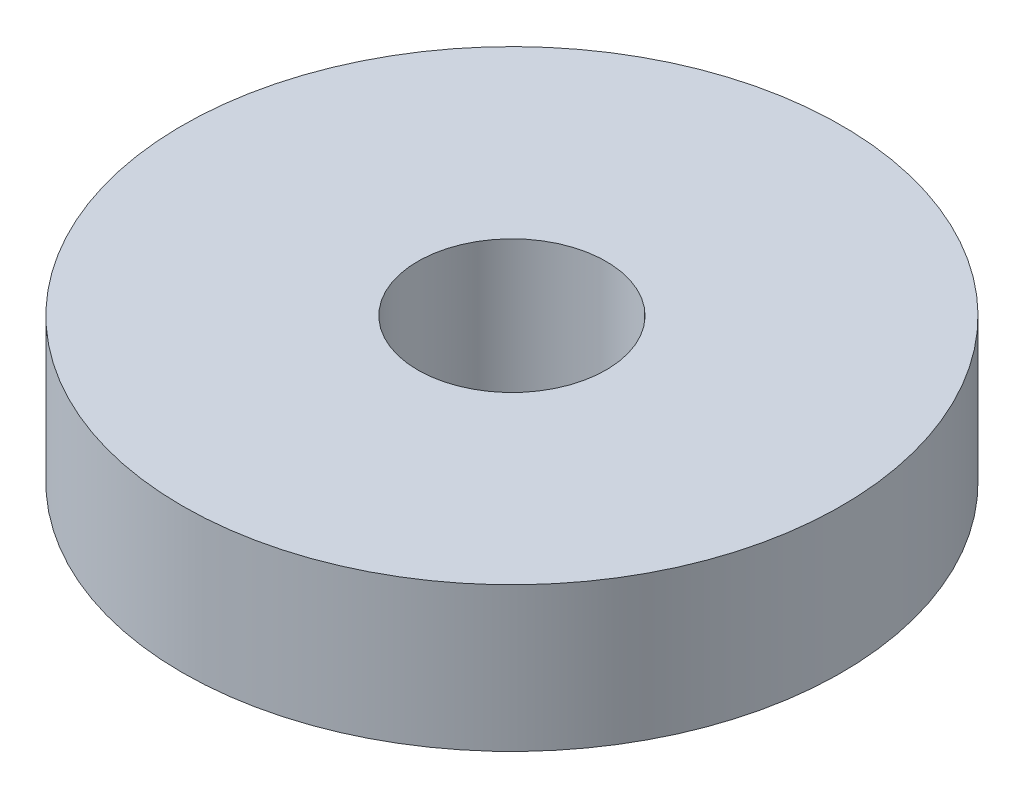
from build123d import *

# Parameters (mm, degrees)
SKETCH1_R           = 52.5
BOSS_EXTRUDE1_DEPTH = 23
SKETCH2_R           = 15
CUT_EXTRUDE1_DEPTH  = 78.727086656


with BuildPart() as part:
    # Sketch1 → Boss-Extrude1 (new body)
    with BuildSketch(Plane(origin=(0, 0, 0), x_dir=(1, 0, 0), z_dir=(0, 1, 0))):
        Circle(SKETCH1_R)
    extrude(amount=BOSS_EXTRUDE1_DEPTH)

    # Sketch2 → Cut-Extrude1 (cut, through all)
    with BuildSketch(Plane(origin=(0, 0, 0), x_dir=(1, 0, 0), z_dir=(0, 1, 0))):
        Circle(SKETCH2_R)
    extrude(amount=CUT_EXTRUDE1_DEPTH, mode=Mode.SUBTRACT)


solid = part.part
